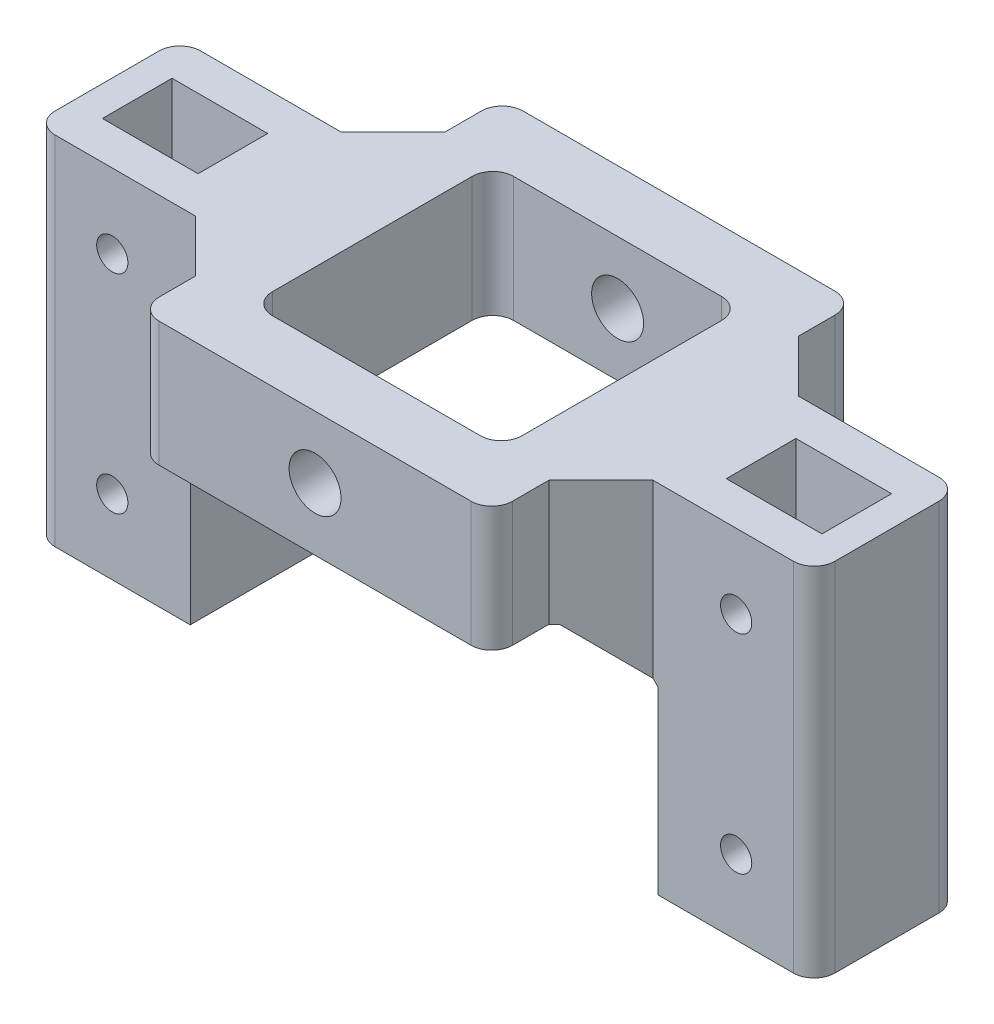
from build123d import *

# Parameters (mm, degrees)
EXTRUDE_1_DEPTH        = 7
EXTRUDE_1_DEPTH_BACK   = 7
SKETCH_1_W             = 15
SKETCH_1_H             = 34.3
SKETCH_1_R             = 1.5
EXTRUDE_1_2_DEPTH      = 7
EXTRUDE_1_2_DEPTH_BACK = 7
SKETCH_2_W             = 9.2
SKETCH_2_H             = 6.7
CUT_EXTRUDE_1_DEPTH    = 62
SKETCH_3_W             = 24
SKETCH_3_H             = 23.2
EXTRUDE_2_DEPTH        = 12
SKETCH_4_R             = 2.5
CUT_EXTRUDE_2_DEPTH    = 90
FILLET_1_R             = 2
CHAMFER_1_SIZE         = 5
CHAMFER_2_SIZE         = 5
FILLET_2_R             = 2


with BuildPart() as part:
    # 草图1 → 凸台-拉伸1 (new, two sides: drawn at the far end of the back side and taken through both)
    with BuildSketch(Plane.XY.offset(-EXTRUDE_1_DEPTH_BACK)):
        with Locations((30, 0)):
            Rectangle(SKETCH_1_W, SKETCH_1_H)
        with Locations((30, 10)):
            Circle(SKETCH_1_R, mode=Mode.SUBTRACT)
        with Locations(Location((30, -10, 0), (0, 0, 180))):
            Circle(SKETCH_1_R, mode=Mode.SUBTRACT)
    extrude(amount=EXTRUDE_1_DEPTH + EXTRUDE_1_DEPTH_BACK)


with BuildPart() as body_2:
    # 草图1 → Extrude 1 2 (new, two sides: drawn at the far end of the back side and taken through both)
    with BuildSketch(Plane.XY.offset(-EXTRUDE_1_2_DEPTH_BACK)):
        with Locations((-30, 0)):
            Rectangle(SKETCH_1_W, SKETCH_1_H)
        with Locations((-30, -10)):
            Circle(SKETCH_1_R, mode=Mode.SUBTRACT)
        with Locations(Location((-30, 10, 0), (0, 0, 180))):
            Circle(SKETCH_1_R, mode=Mode.SUBTRACT)
    extrude(amount=EXTRUDE_1_2_DEPTH + EXTRUDE_1_2_DEPTH_BACK)


with BuildPart() as cut_extrude_1_tool:
    # 草图2 → 切除-拉伸1 (new body)
    with BuildSketch(Plane(origin=(0, 17.15, 0), x_dir=(1, 0, 0), z_dir=(0, 1, 0))):
        with Locations((30, 0)):
            Rectangle(SKETCH_2_W, SKETCH_2_H)
        with Locations((-30, 0)):
            Rectangle(SKETCH_2_W, SKETCH_2_H)
    extrude(amount=-CUT_EXTRUDE_1_DEPTH)


with BuildPart() as part_1:
    add(part.part)

    # 切除-拉伸1: cut by cut_extrude_1_tool
    add(cut_extrude_1_tool.part, mode=Mode.SUBTRACT)



with BuildPart() as body_2_1:
    add(body_2.part)

    # 切除-拉伸1: cut by cut_extrude_1_tool
    add(cut_extrude_1_tool.part, mode=Mode.SUBTRACT)


with BuildPart() as part_2:
    add(part_1.part)

    add(body_2_1.part)  # 凸台-拉伸2 merges body 2
    # 草图3 → 凸台-拉伸2 (add)
    with BuildSketch(Plane(origin=(0, 17.15, 0), x_dir=(1, 0, 0), z_dir=(0, 1, 0))):
        Polygon((22.5, 7), (17, 7), (17, 17.5), (-17, 17.5), (-17, 7), (-22.5, 7), (-22.5, -7), (-17, -7), (-17, -17.5), (17, -17.5), (17, -7), (22.5, -7), align=None)
        Rectangle(SKETCH_3_W, SKETCH_3_H, mode=Mode.SUBTRACT)
    extrude(amount=-EXTRUDE_2_DEPTH)

    # 草图4 → 切除-拉伸2 (cut)
    with BuildSketch(Plane.XY.offset(17.5)):
        with Locations((0, 11.15)):
            Circle(SKETCH_4_R)
    extrude(amount=-CUT_EXTRUDE_2_DEPTH, mode=Mode.SUBTRACT)

    # 圆角1
    fillet_1_edges = [part_2.edges().sort_by_distance(p)[0] for p in [
        (-37.5, 0, -7),
        (-37.5, 0, 7),
        (37.5, 0, 7),
        (37.5, 0, -7),
    ]]
    fillet(fillet_1_edges, radius=FILLET_1_R)

    # 倒角1
    chamfer_1_edges = [part_2.edges().sort_by_distance(p)[0] for p in [
        (22.5, 5.15, 0),
        (-22.5, 5.15, 0),
    ]]
    chamfer(chamfer_1_edges, length=CHAMFER_1_SIZE)

    # 倒角2
    # the kernel refuses this chamfer: 5 mm, written as the material it adds along each edge
    with BuildSketch(Plane(origin=(17, 17.15, -7), x_dir=(0.9996219169112968, 0, 0.027495876610586147), z_dir=(0, -1, 0))) as chamfer_2_piece_1_section:
        Polygon((CHAMFER_2_SIZE * 0.999621916911, -CHAMFER_2_SIZE * 0.0274958766106), (-CHAMFER_2_SIZE * 0.0274958766106, -CHAMFER_2_SIZE * 0.999621916911), (0, 0), align=None)
    chamfer_2_piece_1 = extrude(amount=12, mode=Mode.PRIVATE)
    chamfer_2_piece_1 = split(chamfer_2_piece_1, bisect_by=Plane(origin=(15.061953737, 7.588046263, -8.643148294), z_dir=(0.7071067811865476, 0.7071067811865475, 0)), keep=Keep.TOP, mode=Mode.PRIVATE)
    add(chamfer_2_piece_1)
    with BuildSketch(Plane(origin=(17, 17.15, -7), x_dir=(0.9996219169112968, 0, 0.027495876610586147), z_dir=(0, -1, 0))) as chamfer_2_piece_2_section:
        Polygon((CHAMFER_2_SIZE * 0.999621916911, -CHAMFER_2_SIZE * 0.0274958766106), (-CHAMFER_2_SIZE * 0.0274958766106, -CHAMFER_2_SIZE * 0.999621916911), (0, 0), align=None)
    chamfer_2_piece_2 = extrude(amount=12, mode=Mode.PRIVATE)
    chamfer_2_piece_2 = split(chamfer_2_piece_2, bisect_by=Plane(origin=(17.181894142, 5.468105858, -9.627776216), z_dir=(-0.7071067811865476, -0.7071067811865475, 0)), keep=Keep.TOP, mode=Mode.PRIVATE)
    add(chamfer_2_piece_2)
    with BuildSketch(Plane(origin=(17, 17.15, -7), x_dir=(0.9996219169112968, 0, 0.027495876610586147), z_dir=(0, -1, 0))) as chamfer_2_piece_3_section:
        Polygon((CHAMFER_2_SIZE * 0.999621916911, -CHAMFER_2_SIZE * 0.0274958766106), (-CHAMFER_2_SIZE * 0.0274958766106, -CHAMFER_2_SIZE * 0.999621916911), (0, 0), align=None)
    chamfer_2_piece_3 = extrude(amount=24.85841494, mode=Mode.PRIVATE)
    chamfer_2_piece_3 = split(chamfer_2_piece_3, bisect_by=Plane(origin=(19.269171179, 3.380828821, -8.010149173), z_dir=(0.7071067811865476, 0.7071067811865475, 0)), keep=Keep.TOP, mode=Mode.PRIVATE)
    chamfer_2_piece_3 = split(chamfer_2_piece_3, bisect_by=Plane(origin=(19.858894906, 5.15, -8.010149173), z_dir=(0, -1, 0)), keep=Keep.TOP, mode=Mode.PRIVATE)
    add(chamfer_2_piece_3)
    with BuildSketch(Plane(origin=(-17, 17.15, -7), x_dir=(0.027495876610586313, 0, -0.9996219169112968), z_dir=(0, -1, 0))) as chamfer_2_piece_4_section:
        Polygon((CHAMFER_2_SIZE * 0.999621916911, -CHAMFER_2_SIZE * 0.0274958766106), (-CHAMFER_2_SIZE * 0.0274958766106, -CHAMFER_2_SIZE * 0.999621916911), (0, 0), align=None)
    chamfer_2_piece_4 = extrude(amount=12, mode=Mode.PRIVATE)
    chamfer_2_piece_4 = split(chamfer_2_piece_4, bisect_by=Plane(origin=(-15.061953737, 7.588046263, -8.643148294), z_dir=(-0.7071067811865475, 0.7071067811865476, 0)), keep=Keep.TOP, mode=Mode.PRIVATE)
    add(chamfer_2_piece_4)
    with BuildSketch(Plane(origin=(-17, 17.15, -7), x_dir=(0.027495876610586313, 0, -0.9996219169112968), z_dir=(0, -1, 0))) as chamfer_2_piece_5_section:
        Polygon((CHAMFER_2_SIZE * 0.999621916911, -CHAMFER_2_SIZE * 0.0274958766106), (-CHAMFER_2_SIZE * 0.0274958766106, -CHAMFER_2_SIZE * 0.999621916911), (0, 0), align=None)
    chamfer_2_piece_5 = extrude(amount=24.85841494, mode=Mode.PRIVATE)
    chamfer_2_piece_5 = split(chamfer_2_piece_5, bisect_by=Plane(origin=(-19.858894906, 5.15, -8.010149173), z_dir=(0, -1, 0)), keep=Keep.TOP, mode=Mode.PRIVATE)
    chamfer_2_piece_5 = split(chamfer_2_piece_5, bisect_by=Plane(origin=(-19.269171179, 3.380828821, -8.010149173), z_dir=(-0.7071067811865475, 0.7071067811865476, 0)), keep=Keep.TOP, mode=Mode.PRIVATE)
    add(chamfer_2_piece_5)
    with BuildSketch(Plane(origin=(-17, 17.15, -7), x_dir=(0.027495876610586313, 0, -0.9996219169112968), z_dir=(0, -1, 0))) as chamfer_2_piece_6_section:
        Polygon((CHAMFER_2_SIZE * 0.999621916911, -CHAMFER_2_SIZE * 0.0274958766106), (-CHAMFER_2_SIZE * 0.0274958766106, -CHAMFER_2_SIZE * 0.999621916911), (0, 0), align=None)
    chamfer_2_piece_6 = extrude(amount=12, mode=Mode.PRIVATE)
    chamfer_2_piece_6 = split(chamfer_2_piece_6, bisect_by=Plane(origin=(-17.181894142, 5.468105858, -9.627776216), z_dir=(0.7071067811865475, -0.7071067811865476, 0)), keep=Keep.TOP, mode=Mode.PRIVATE)
    add(chamfer_2_piece_6)
    with BuildSketch(Plane(origin=(17, 17.15, 7), x_dir=(0.9996219169112968, 0, -0.027495876610586147), z_dir=(0, -1, 0))) as chamfer_2_piece_7_section:
        Polygon((CHAMFER_2_SIZE * 0.999621916911, CHAMFER_2_SIZE * 0.0274958766106), (-CHAMFER_2_SIZE * 0.0274958766106, CHAMFER_2_SIZE * 0.999621916911), (0, 0), align=None)
    chamfer_2_piece_7 = extrude(amount=12, mode=Mode.PRIVATE)
    chamfer_2_piece_7 = split(chamfer_2_piece_7, bisect_by=Plane(origin=(15.061953737, 7.588046263, 8.643148294), z_dir=(0.7071067811865476, 0.7071067811865475, 0)), keep=Keep.TOP, mode=Mode.PRIVATE)
    add(chamfer_2_piece_7)
    with BuildSketch(Plane(origin=(17, 17.15, 7), x_dir=(0.9996219169112968, 0, -0.027495876610586147), z_dir=(0, -1, 0))) as chamfer_2_piece_8_section:
        Polygon((CHAMFER_2_SIZE * 0.999621916911, CHAMFER_2_SIZE * 0.0274958766106), (-CHAMFER_2_SIZE * 0.0274958766106, CHAMFER_2_SIZE * 0.999621916911), (0, 0), align=None)
    chamfer_2_piece_8 = extrude(amount=12, mode=Mode.PRIVATE)
    chamfer_2_piece_8 = split(chamfer_2_piece_8, bisect_by=Plane(origin=(17.181894142, 5.468105858, 9.627776216), z_dir=(-0.7071067811865476, -0.7071067811865475, 0)), keep=Keep.TOP, mode=Mode.PRIVATE)
    add(chamfer_2_piece_8)
    with BuildSketch(Plane(origin=(17, 17.15, 7), x_dir=(0.9996219169112968, 0, -0.027495876610586147), z_dir=(0, -1, 0))) as chamfer_2_piece_9_section:
        Polygon((CHAMFER_2_SIZE * 0.999621916911, CHAMFER_2_SIZE * 0.0274958766106), (-CHAMFER_2_SIZE * 0.0274958766106, CHAMFER_2_SIZE * 0.999621916911), (0, 0), align=None)
    chamfer_2_piece_9 = extrude(amount=24.85841494, mode=Mode.PRIVATE)
    chamfer_2_piece_9 = split(chamfer_2_piece_9, bisect_by=Plane(origin=(19.269171179, 3.380828821, 8.010149173), z_dir=(0.7071067811865476, 0.7071067811865475, 0)), keep=Keep.TOP, mode=Mode.PRIVATE)
    chamfer_2_piece_9 = split(chamfer_2_piece_9, bisect_by=Plane(origin=(19.858894906, 5.15, 8.010149173), z_dir=(0, -1, 0)), keep=Keep.TOP, mode=Mode.PRIVATE)
    add(chamfer_2_piece_9)
    with BuildSketch(Plane(origin=(-17, 17.15, 7), x_dir=(0.027495876610586313, 0, 0.9996219169112968), z_dir=(0, -1, 0))) as chamfer_2_piece_10_section:
        Polygon((CHAMFER_2_SIZE * 0.999621916911, CHAMFER_2_SIZE * 0.0274958766106), (-CHAMFER_2_SIZE * 0.0274958766106, CHAMFER_2_SIZE * 0.999621916911), (0, 0), align=None)
    chamfer_2_piece_10 = extrude(amount=12, mode=Mode.PRIVATE)
    chamfer_2_piece_10 = split(chamfer_2_piece_10, bisect_by=Plane(origin=(-15.061953737, 7.588046263, 8.643148294), z_dir=(-0.7071067811865475, 0.7071067811865476, 0)), keep=Keep.TOP, mode=Mode.PRIVATE)
    add(chamfer_2_piece_10)
    with BuildSketch(Plane(origin=(-17, 17.15, 7), x_dir=(0.027495876610586313, 0, 0.9996219169112968), z_dir=(0, -1, 0))) as chamfer_2_piece_11_section:
        Polygon((CHAMFER_2_SIZE * 0.999621916911, CHAMFER_2_SIZE * 0.0274958766106), (-CHAMFER_2_SIZE * 0.0274958766106, CHAMFER_2_SIZE * 0.999621916911), (0, 0), align=None)
    chamfer_2_piece_11 = extrude(amount=24.85841494, mode=Mode.PRIVATE)
    chamfer_2_piece_11 = split(chamfer_2_piece_11, bisect_by=Plane(origin=(-19.858894906, 5.15, 8.010149173), z_dir=(0, -1, 0)), keep=Keep.TOP, mode=Mode.PRIVATE)
    chamfer_2_piece_11 = split(chamfer_2_piece_11, bisect_by=Plane(origin=(-19.269171179, 3.380828821, 8.010149173), z_dir=(-0.7071067811865475, 0.7071067811865476, 0)), keep=Keep.TOP, mode=Mode.PRIVATE)
    add(chamfer_2_piece_11)
    with BuildSketch(Plane(origin=(-17, 17.15, 7), x_dir=(0.027495876610586313, 0, 0.9996219169112968), z_dir=(0, -1, 0))) as chamfer_2_piece_12_section:
        Polygon((CHAMFER_2_SIZE * 0.999621916911, CHAMFER_2_SIZE * 0.0274958766106), (-CHAMFER_2_SIZE * 0.0274958766106, CHAMFER_2_SIZE * 0.999621916911), (0, 0), align=None)
    chamfer_2_piece_12 = extrude(amount=12, mode=Mode.PRIVATE)
    chamfer_2_piece_12 = split(chamfer_2_piece_12, bisect_by=Plane(origin=(-17.181894142, 5.468105858, 9.627776216), z_dir=(0.7071067811865475, -0.7071067811865476, 0)), keep=Keep.TOP, mode=Mode.PRIVATE)
    add(chamfer_2_piece_12)

    # 圆角2
    fillet_2_edges = [part_2.edges().sort_by_distance(p)[0] for p in [
        (12, 11.15, -11.6),
        (17, 11.15, 17.5),
        (-17, 11.15, 17.5),
        (-17, 11.15, -17.5),
        (17, 11.15, -17.5),
        (12, 11.15, 11.6),
        (-12, 11.15, 11.6),
        (-12, 11.15, -11.6),
    ]]
    fillet(fillet_2_edges, radius=FILLET_2_R)


solid = part_2.part
